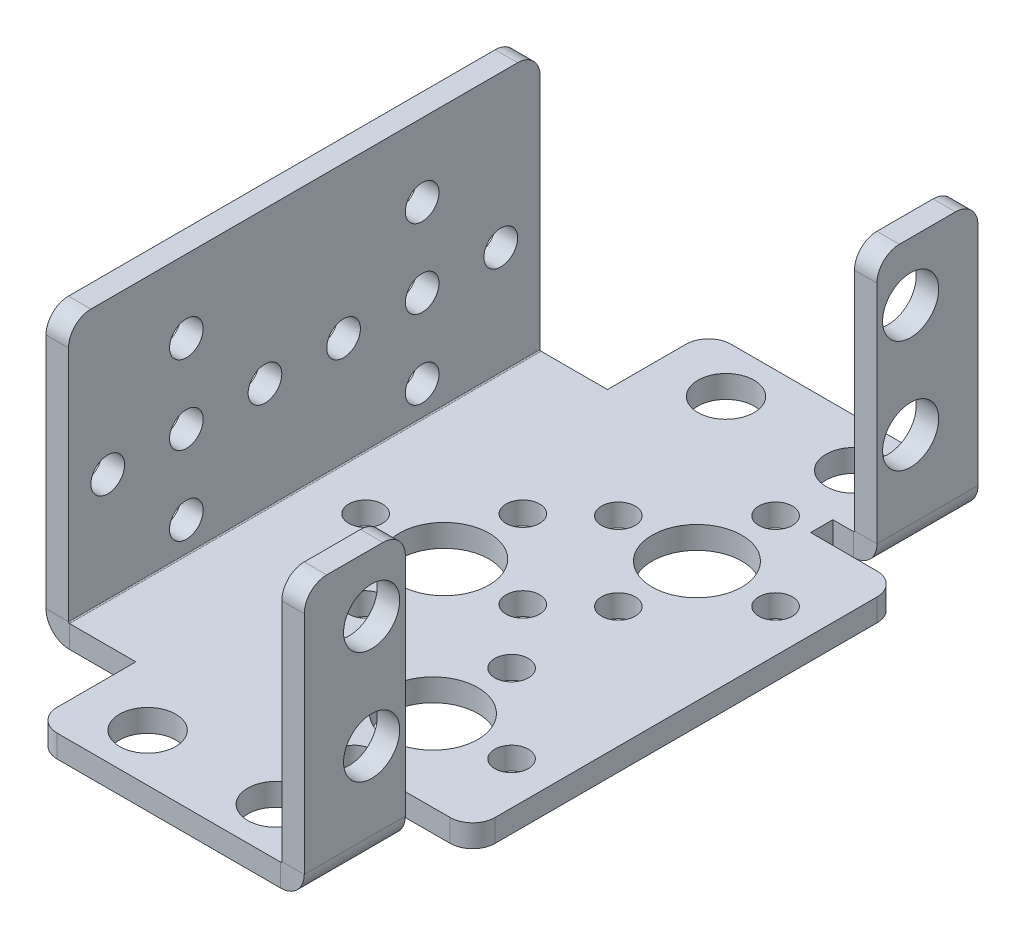
from build123d import *
from build123d.topology import SkipClean

# Parameters (mm, degrees)
BOSS_EXTRUDE1_DEPTH          = 42
FILLET1_R                    = 2
BOSS_EXTRUDE2_DEPTH          = 9.000000000000002
FILLET2_R                    = 2
CUT_EXTRUDE1_DEPTH           = 9.000000000000002
FILLET3_R                    = 2
FILLET2_OF_MIRROR3_R         = 2
FILLET3_OF_MIRROR3_R         = 2
SKETCH5_R                    = 1.5000000000002172
SKETCH5_R_2                  = 1.5000000000003697
SKETCH5_R_3                  = 1.5000000000003695
SKETCH5_R_4                  = 1.5000000000003573
SKETCH5_R_5                  = 1.5000000000003533
CUT_EXTRUDE2_DEPTH           = 9.000000000000002
SKETCH7_R                    = 2.499999999999999
CUT_EXTRUDE3_DEPTH           = 9.000000000000002
SKETCH8_R                    = 2.5000000000000027
SKETCH8_R_2                  = 2.5000000000000018
CUT_EXTRUDE4_DEPTH           = 9.000000000000002
SKETCH9_R                    = 3.999999999999999
SKETCH9_R_2                  = 1.5000000000000007
SKETCH9_R_3                  = 1.4999999999999987
SKETCH9_R_4                  = 1.500000000000001
SKETCH9_R_5                  = 1.5000000000000036
CUT_EXTRUDE5_DEPTH           = 9.000000000000002
SKETCH10_R                   = 3.9999999999999973
SKETCH10_R_2                 = 1.4999999999999987
SKETCH10_R_3                 = 1.4999999999999956
SKETCH10_R_4                 = 1.4999999999999993
SKETCH10_R_5                 = 1.4999999999999991
CUT_EXTRUDE6_DEPTH           = 9.000000000000002
CONVERT_SOLID2_START         = -0.019038241
CONVERT_SOLID2_OUTLINE_R     = 2.5
CONVERT_SOLID2_OUTLINE_R_2   = 1.5
CONVERT_SOLID2_OUTLINE_R_3   = 4
CONVERT_SOLID2_DEPTH         = 0.019038241
CONVERT_SOLID2_START_2       = -0.207798241
CONVERT_SOLID2_2_OUTLINE_R   = 2.5
CONVERT_SOLID2_2_OUTLINE_R_2 = 1.5
CONVERT_SOLID2_2_OUTLINE_R_3 = 4
CONVERT_SOLID2_2_DEPTH       = 2.1
CONVERT_SOLID2_3_OUTLINE_W   = 1.9999999999999964
CONVERT_SOLID2_3_OUTLINE_H   = 9.000000000000007
CONVERT_SOLID2_3_OUTLINE_W_2 = 2
CONVERT_SOLID2_3_OUTLINE_H_2 = 42
CONVERT_SOLID2_3_OUTLINE_H_3 = 9
CONVERT_SOLID2_3_DEPTH       = 0.207798241
CONVERT_SOLID2_START_3       = -10
CONVERT_SOLID2_4_DEPTH       = 62
CONVERT_SOLID2_5_DEPTH       = 10
CONVERT_SOLID2_START_4       = 42
CONVERT_SOLID2_6_DEPTH       = 10
CONVERT_SOLID2_7_DEPTH       = 42


with BuildPart() as part:
    # Sketch2 → Boss-Extrude1 (new body)
    with BuildSketch(Plane.XY):
        Polygon((0, 0), (36.00000000000001, 0), (36.00000000000001, 1.792201758818307), (2, 1.792201758818307), (2, 25), (0, 25), align=None)
    extrude(amount=BOSS_EXTRUDE1_DEPTH)

    # Fillet1
    fillet1_edges = [part.edges().sort_by_distance(p)[0] for p in [
        (1, 25, 42),
        (36.00000000000001, 0.8961008794091535, 42),
        (1, 25, 0),
        (36.00000000000001, 0.8961008794091535, 0),
    ]]
    fillet(fillet1_edges, radius=FILLET1_R)

    # Sketch3 → Boss-Extrude2 (add)
    with BuildSketch(Plane(origin=(0, 0, 0), x_dir=(-1, 0, 0), z_dir=(0, 0, -1))):
        Polygon((-7.9999999999688685, 1.792201758818307), (-7.9999999999688685, 0), (-31.99999999996887, 0), (-31.99999999996887, 24), (-29.99999999996887, 24), (-29.99999999996887, 1.792201758818307), align=None)
    boss_extrude2 = extrude(amount=BOSS_EXTRUDE2_DEPTH)

    # Fillet2
    fillet2_edges = [part.edges().sort_by_distance(p)[0] for p in [
        (30.99999999996887, 24, -9.000000000000002),
        (7.9999999999688685, 0.8961008794091535, -9.000000000000002),
        (30.99999999996887, 24, 0),
    ]]
    fillet(fillet2_edges, radius=FILLET2_R)

    # Sketch4 → Cut-Extrude1 (cut)
    with BuildSketch(Plane(origin=(0, 1.792201758818307, 0), x_dir=(1, 0, 0), z_dir=(0, 1, 0))):
        with BuildLine():
            Line((28.075602477749072, 0), (28.075602477749072, -1.9780790199244238))
            Line((28.075602477749072, -1.9780790199244238), (36.00000000000001, -2.0000000000000155))
            ThreePointArc((36.00000000000001, -2.0000000000000155), (35.415834928437526, -0.5841650715624853), (34, 0))
            Line((34, 0), (28.075602477749072, 0))
        make_face()
    cut_extrude1 = extrude(amount=-CUT_EXTRUDE1_DEPTH, mode=Mode.SUBTRACT)

    # Fillet3
    fillet3_edges = [part.edges().sort_by_distance(p)[0] for p in [
        (36.00000000000001, 0.8961008794091535, 1.9999999999999996),
    ]]
    fillet(fillet3_edges, radius=FILLET3_R)

    # Mirror3: Boss-Extrude2, Cut-Extrude1 across plane
    add(boss_extrude2.mirror(Plane(origin=(0, 0, 21), x_dir=(1, 0, 0), z_dir=(0, 0, -1))))
    add(cut_extrude1.mirror(Plane(origin=(0, 0, 21), x_dir=(1, 0, 0), z_dir=(0, 0, -1))), mode=Mode.SUBTRACT)

    # Fillet2 of Mirror3
    fillet2_of_mirror3_edges = [part.edges().sort_by_distance(p)[0] for p in [
        (30.99999999996887, 24, 51),
        (7.9999999999688685, 0.8961008794091535, 51),
        (30.99999999996887, 24, 42),
    ]]
    fillet(fillet2_of_mirror3_edges, radius=FILLET2_OF_MIRROR3_R)

    # Fillet3 of Mirror3
    fillet3_of_mirror3_edges = [part.edges().sort_by_distance(p)[0] for p in [
        (36.00000000000001, 0.8961008794091535, 40),
    ]]
    fillet(fillet3_of_mirror3_edges, radius=FILLET3_OF_MIRROR3_R)

    # Sketch5 → Cut-Extrude2 (cut)
    with BuildSketch(Plane.ZY):
        with Locations((38.5, 11.500000000000002)):
            Circle(SKETCH5_R)
        with Locations((31.5, 11.499999999999856)):
            Circle(SKETCH5_R)
        with Locations((24.5, 11.499999999999712)):
            Circle(SKETCH5_R)
        with Locations((17.5, 11.499999999999567)):
            Circle(SKETCH5_R)
        with Locations((10.500000000000002, 11.499999999999421)):
            Circle(SKETCH5_R)
        with Locations((3.500000000000003, 11.499999999999275)):
            Circle(SKETCH5_R)
        with Locations((31.5, 18.49999999999927)):
            Circle(SKETCH5_R_2)
        with Locations((31.5, 4.499999999999271)):
            Circle(SKETCH5_R_3)
        with Locations((10.500000000000002, 18.49999999999927)):
            Circle(SKETCH5_R_4)
        with Locations((10.500000000000002, 4.499999999999271)):
            Circle(SKETCH5_R_5)
    extrude(amount=-CUT_EXTRUDE2_DEPTH, mode=Mode.SUBTRACT)

    # Sketch7 → Cut-Extrude3 (cut)
    with BuildSketch(Plane(origin=(0, 1.792201758818307, 0), x_dir=(1, 0, 0), z_dir=(0, 1, 0))):
        with Locations(Location((25.217307954125484, -46.75445675536823, 0), (0, 0, 270))):
            Circle(SKETCH7_R)
        with Locations(Location((13.806043378017337, -46.75445675536823, 0), (0, 0, 270))):
            Circle(SKETCH7_R)
    cut_extrude3 = extrude(amount=-CUT_EXTRUDE3_DEPTH, mode=Mode.SUBTRACT)

    # Mirror4: Cut-Extrude3 across plane
    add(cut_extrude3.mirror(Plane(origin=(0, 0, 21), x_dir=(1, 0, 0), z_dir=(0, 0, -1))), mode=Mode.SUBTRACT)

    # Sketch8 → Cut-Extrude4 (cut)
    with BuildSketch(Plane.ZY.offset(-29.99999999996887)):
        with Locations((45.00000000000001, 18.801060863987583)):
            Circle(SKETCH8_R)
        with Locations((45.00000000000001, 8.801060863987583)):
            Circle(SKETCH8_R_2)
    cut_extrude4 = extrude(amount=-CUT_EXTRUDE4_DEPTH, mode=Mode.SUBTRACT)

    # Mirror5: Cut-Extrude4 across plane
    add(cut_extrude4.mirror(Plane(origin=(0, 0, 21), x_dir=(1, 0, 0), z_dir=(0, 0, -1))), mode=Mode.SUBTRACT)

    # Sketch9 → Cut-Extrude5 (cut)
    with BuildSketch(Plane(origin=(0, 1.792201758818307, 0), x_dir=(1, 0, 0), z_dir=(0, 1, 0))):
        with Locations(Location((25.217307954125484, -9.245543244631769, 0), (0, 0, 270))):
            Circle(SKETCH9_R)
        with Locations(Location((25.217307954125484, -2.245543244631767, 0), (0, 0, 270))):
            Circle(SKETCH9_R_2)
        with Locations(Location((32.217307954125594, -9.2455432446317, 0), (0, 0, 270))):
            Circle(SKETCH9_R_3)
        with Locations(Location((25.21730795412564, -16.24554324463177, 0), (0, 0, 270))):
            Circle(SKETCH9_R_4)
        with Locations(Location((18.217307954125584, -9.245543244631788, 0), (0, 0, 270))):
            Circle(SKETCH9_R_5)
    cut_extrude5 = extrude(amount=-CUT_EXTRUDE5_DEPTH, mode=Mode.SUBTRACT)

    # Mirror6: Cut-Extrude5 across plane
    add(cut_extrude5.mirror(Plane(origin=(0, 0, 21), x_dir=(1, 0, 0), z_dir=(0, 0, -1))), mode=Mode.SUBTRACT)

    # Sketch10 → Cut-Extrude6 (cut)
    with BuildSketch(Plane(origin=(0, 1.792201758818307, 0), x_dir=(1, 0, 0), z_dir=(0, 1, 0))):
        with Locations(Location((13.806043378017343, -20.341463841857735, 0), (0, 0, 270))):
            Circle(SKETCH10_R)
        with Locations(Location((13.806043378017339, -13.341463841857818, 0), (0, 0, 270))):
            Circle(SKETCH10_R_2)
        with Locations(Location((20.806043378017538, -20.341463841857642, 0), (0, 0, 270))):
            Circle(SKETCH10_R_3)
        with Locations(Location((13.806043378017685, -27.341463841857816, 0), (0, 0, 270))):
            Circle(SKETCH10_R_4)
        with Locations(Location((6.806043378017533, -20.34146384185794, 0), (0, 0, 270))):
            Circle(SKETCH10_R_5)
    extrude(amount=-CUT_EXTRUDE6_DEPTH, mode=Mode.SUBTRACT)

    # Convert-Solid2: read off the stored shape, not the designer's step
    # Convert-Solid2 outline → Convert-Solid2 (add)
    with BuildSketch(Plane(origin=(0, 0, 0), x_dir=(1, 0, 0), z_dir=(0, 1, 0)).offset(CONVERT_SOLID2_START)):
        with BuildLine():
            Line((30, -42), (28.075602478, -42))
            Line((28.075602478, -42), (28.075602478, -40.02192098))
            Line((28.075602478, -40.02192098), (34.005532508, -40.005517225))
            ThreePointArc((34.005532508, -40.005517225), (35.416168248, -39.417781048), (36, -38.005524877))
            Line((36, -38.005524877), (36, -3.994475123))
            ThreePointArc((36, -3.994475123), (35.416168248, -2.582218952), (34.005532508, -1.994482775))
            Line((34.005532508, -1.994482775), (28.075602478, -1.97807902))
            Line((28.075602478, -1.97807902), (28.075602478, 0))
            Line((28.075602478, 0), (30, 0))
            Line((30, 0), (30, 9))
            Line((30, 9), (10, 9))
            ThreePointArc((10, 9), (8.585786438, 8.414213562), (8, 7))
            Line((8, 7), (8, 0))
            Line((8, 0), (2, 0))
            Line((2, 0), (2, -42))
            Line((2, -42), (8, -42))
            Line((8, -42), (8, -49))
            ThreePointArc((8, -49), (8.585786438, -50.414213562), (10, -51))
            Line((10, -51), (30, -51))
            Line((30, -51), (30, -42))
        make_face()
        with Locations((13.806043378, -46.754456755)):
            Circle(CONVERT_SOLID2_OUTLINE_R, mode=Mode.SUBTRACT)
        with Locations((13.806043378, -27.341463842)):
            Circle(CONVERT_SOLID2_OUTLINE_R_2, mode=Mode.SUBTRACT)
        with Locations((25.217307954, -46.754456755)):
            Circle(CONVERT_SOLID2_OUTLINE_R, mode=Mode.SUBTRACT)
        with Locations((25.217307954, -39.754456755)):
            Circle(CONVERT_SOLID2_OUTLINE_R_2, mode=Mode.SUBTRACT)
        with Locations((18.217307954, -32.754456755)):
            Circle(CONVERT_SOLID2_OUTLINE_R_2, mode=Mode.SUBTRACT)
        with Locations((25.217307954, -32.754456755)):
            Circle(CONVERT_SOLID2_OUTLINE_R_3, mode=Mode.SUBTRACT)
        with Locations((25.217307954, -25.754456755)):
            Circle(CONVERT_SOLID2_OUTLINE_R_2, mode=Mode.SUBTRACT)
        with Locations((32.217307954, -32.754456755)):
            Circle(CONVERT_SOLID2_OUTLINE_R_2, mode=Mode.SUBTRACT)
        with Locations((6.806043378, -20.341463842)):
            Circle(CONVERT_SOLID2_OUTLINE_R_2, mode=Mode.SUBTRACT)
        with Locations((13.806043378, -20.341463842)):
            Circle(CONVERT_SOLID2_OUTLINE_R_3, mode=Mode.SUBTRACT)
        with Locations((13.806043378, -13.341463842)):
            Circle(CONVERT_SOLID2_OUTLINE_R_2, mode=Mode.SUBTRACT)
        with Locations((13.806043378, 4.754456755)):
            Circle(CONVERT_SOLID2_OUTLINE_R, mode=Mode.SUBTRACT)
        with Locations((20.806043378, -20.341463842)):
            Circle(CONVERT_SOLID2_OUTLINE_R_2, mode=Mode.SUBTRACT)
        with Locations((25.217307954, -16.245543245)):
            Circle(CONVERT_SOLID2_OUTLINE_R_2, mode=Mode.SUBTRACT)
        with Locations((18.217307954, -9.245543245)):
            Circle(CONVERT_SOLID2_OUTLINE_R_2, mode=Mode.SUBTRACT)
        with Locations((25.217307954, -9.245543245)):
            Circle(CONVERT_SOLID2_OUTLINE_R_3, mode=Mode.SUBTRACT)
        with Locations((32.217307954, -9.245543245)):
            Circle(CONVERT_SOLID2_OUTLINE_R_2, mode=Mode.SUBTRACT)
        with Locations((25.217307954, -2.245543245)):
            Circle(CONVERT_SOLID2_OUTLINE_R_2, mode=Mode.SUBTRACT)
        with Locations((25.217307954, 4.754456755)):
            Circle(CONVERT_SOLID2_OUTLINE_R, mode=Mode.SUBTRACT)
    extrude(amount=CONVERT_SOLID2_DEPTH)

    # Convert-Solid2 2 outline → Convert-Solid2 2 (add)
    with SkipClean():  # the faces are left unmerged after this step: merging them gives an invalid solid
        with BuildSketch(Plane(origin=(0, 0, 0), x_dir=(1, 0, 0), z_dir=(0, 1, 0)).offset(CONVERT_SOLID2_START_2)):
            with BuildLine():
                Line((30, -51), (30, -42))
                Line((30, -42), (28.075602478, -42))
                Line((28.075602478, -42), (28.075602478, -40.02192098))
                Line((28.075602478, -40.02192098), (34.005532508, -40.005517225))
                ThreePointArc((34.005532508, -40.005517225), (35.416168248, -39.417781048), (36, -38.005524877))
                Line((36, -38.005524877), (36, -3.994475123))
                ThreePointArc((36, -3.994475123), (35.416168248, -2.582218952), (34.005532508, -1.994482775))
                Line((34.005532508, -1.994482775), (28.075602478, -1.97807902))
                Line((28.075602478, -1.97807902), (28.075602478, 0))
                Line((28.075602478, 0), (30, 0))
                Line((30, 0), (30, 9))
                Line((30, 9), (10, 9))
                ThreePointArc((10, 9), (8.585786438, 8.414213562), (8, 7))
                Line((8, 7), (8, 0))
                Line((8, 0), (2, 0))
                Line((2, 0), (2, -42))
                Line((2, -42), (8, -42))
                Line((8, -42), (8, -49))
                ThreePointArc((8, -49), (8.585786438, -50.414213562), (10, -51))
                Line((10, -51), (30, -51))
            make_face()
            with Locations((13.806043378, -46.754456755)):
                Circle(CONVERT_SOLID2_2_OUTLINE_R, mode=Mode.SUBTRACT)
            with Locations((13.806043378, -27.341463842)):
                Circle(CONVERT_SOLID2_2_OUTLINE_R_2, mode=Mode.SUBTRACT)
            with Locations((25.217307954, -46.754456755)):
                Circle(CONVERT_SOLID2_2_OUTLINE_R, mode=Mode.SUBTRACT)
            with Locations((25.217307954, -39.754456755)):
                Circle(CONVERT_SOLID2_2_OUTLINE_R_2, mode=Mode.SUBTRACT)
            with Locations((18.217307954, -32.754456755)):
                Circle(CONVERT_SOLID2_2_OUTLINE_R_2, mode=Mode.SUBTRACT)
            with Locations((25.217307954, -32.754456755)):
                Circle(CONVERT_SOLID2_2_OUTLINE_R_3, mode=Mode.SUBTRACT)
            with Locations((25.217307954, -25.754456755)):
                Circle(CONVERT_SOLID2_2_OUTLINE_R_2, mode=Mode.SUBTRACT)
            with Locations((32.217307954, -32.754456755)):
                Circle(CONVERT_SOLID2_2_OUTLINE_R_2, mode=Mode.SUBTRACT)
            with Locations((6.806043378, -20.341463842)):
                Circle(CONVERT_SOLID2_2_OUTLINE_R_2, mode=Mode.SUBTRACT)
            with Locations((13.806043378, -20.341463842)):
                Circle(CONVERT_SOLID2_2_OUTLINE_R_3, mode=Mode.SUBTRACT)
            with Locations((13.806043378, -13.341463842)):
                Circle(CONVERT_SOLID2_2_OUTLINE_R_2, mode=Mode.SUBTRACT)
            with Locations((13.806043378, 4.754456755)):
                Circle(CONVERT_SOLID2_2_OUTLINE_R, mode=Mode.SUBTRACT)
            with Locations((20.806043378, -20.341463842)):
                Circle(CONVERT_SOLID2_2_OUTLINE_R_2, mode=Mode.SUBTRACT)
            with Locations((25.217307954, -16.245543245)):
                Circle(CONVERT_SOLID2_2_OUTLINE_R_2, mode=Mode.SUBTRACT)
            with Locations((18.217307954, -9.245543245)):
                Circle(CONVERT_SOLID2_2_OUTLINE_R_2, mode=Mode.SUBTRACT)
            with Locations((25.217307954, -9.245543245)):
                Circle(CONVERT_SOLID2_2_OUTLINE_R_3, mode=Mode.SUBTRACT)
            with Locations((32.217307954, -9.245543245)):
                Circle(CONVERT_SOLID2_2_OUTLINE_R_2, mode=Mode.SUBTRACT)
            with Locations((25.217307954, -2.245543245)):
                Circle(CONVERT_SOLID2_2_OUTLINE_R_2, mode=Mode.SUBTRACT)
            with Locations((25.217307954, 4.754456755)):
                Circle(CONVERT_SOLID2_2_OUTLINE_R, mode=Mode.SUBTRACT)
        extrude(amount=CONVERT_SOLID2_2_DEPTH)

    # Convert-Solid2 3 outline → Convert-Solid2 3 (add)
    with SkipClean():  # the faces are left unmerged after this step: merging them gives an invalid solid
        with BuildSketch(Plane(origin=(0, 0, 0), x_dir=(1, 0, 0), z_dir=(0, 1, 0)).offset(CONVERT_SOLID2_START_2)):
            with Locations((31, -46.5)):
                Rectangle(CONVERT_SOLID2_3_OUTLINE_W, CONVERT_SOLID2_3_OUTLINE_H)
            with Locations((1, -21)):
                Rectangle(CONVERT_SOLID2_3_OUTLINE_W_2, CONVERT_SOLID2_3_OUTLINE_H_2)
            with Locations((31, 4.5)):
                Rectangle(CONVERT_SOLID2_3_OUTLINE_W, CONVERT_SOLID2_3_OUTLINE_H_3)
        extrude(amount=CONVERT_SOLID2_3_DEPTH)

    # Convert-Solid2 4 outline → Convert-Solid2 4 (cut)
    with BuildSketch(Plane.XY.offset(CONVERT_SOLID2_START_3)):
        with BuildLine():
            ThreePointArc((29.9, 1.792201759), (29.970710678, 1.821491081), (30, 1.892201759))
            Line((30, 1.892201759), (2, 1.892201759))
            ThreePointArc((2, 1.892201759), (2.029289322, 1.821491081), (2.1, 1.792201759))
            Line((2.1, 1.792201759), (29.9, 1.792201759))
        make_face()
        with BuildLine():
            ThreePointArc((32, 1.892201759), (31.99940434, 1.842187573), (31.997617696, 1.792201759))
            Line((31.997617696, 1.792201759), (36, 1.792201759))
            Line((36, 1.792201759), (36, 1.892201759))
            Line((36, 1.892201759), (32, 1.892201759))
        make_face()
        with BuildLine():
            Line((0, -0.207798241), (2.1, -0.207798241))
            ThreePointArc((2.1, -0.207798241), (0.61507576, 0.407277518), (0, 1.892201759))
            Line((0, 1.892201759), (0, -0.207798241))
        make_face()
    extrude(amount=CONVERT_SOLID2_4_DEPTH, mode=Mode.SUBTRACT)

    # Convert-Solid2 5 outline → Convert-Solid2 5 (cut)
    with BuildSketch(Plane.XY.offset(CONVERT_SOLID2_START_3)):
        with BuildLine():
            Line((32, 1.792201759), (31.997617696, 1.792201759))
            ThreePointArc((31.997617696, 1.792201759), (31.349137675, 0.372333344), (29.9, -0.207798241))
            Line((29.9, -0.207798241), (32, -0.207798241))
            Line((32, -0.207798241), (32, 1.792201759))
        make_face()
    extrude(amount=CONVERT_SOLID2_5_DEPTH, mode=Mode.SUBTRACT)

    # Convert-Solid2 6 outline → Convert-Solid2 6 (cut)
    with BuildSketch(Plane.XY.offset(CONVERT_SOLID2_START_4)):
        with BuildLine():
            Line((32, 1.792201759), (31.997617696, 1.792201759))
            ThreePointArc((31.997617696, 1.792201759), (31.349137675, 0.372333344), (29.9, -0.207798241))
            Line((29.9, -0.207798241), (32, -0.207798241))
            Line((32, -0.207798241), (32, 1.792201759))
        make_face()
    extrude(amount=CONVERT_SOLID2_6_DEPTH, mode=Mode.SUBTRACT)

    # Convert-Solid2 7 outline → Convert-Solid2 7 (cut)
    with BuildSketch(Plane.XY):
        with BuildLine():
            ThreePointArc((30, 1.892201759), (29.970710678, 1.821491081), (29.9, 1.792201759))
            Line((29.9, 1.792201759), (31.997617696, 1.792201759))
            ThreePointArc((31.997617696, 1.792201759), (31.99940434, 1.842187573), (32, 1.892201759))
            Line((32, 1.892201759), (30, 1.892201759))
        make_face()
    extrude(amount=CONVERT_SOLID2_7_DEPTH, mode=Mode.SUBTRACT)


solid = part.part
